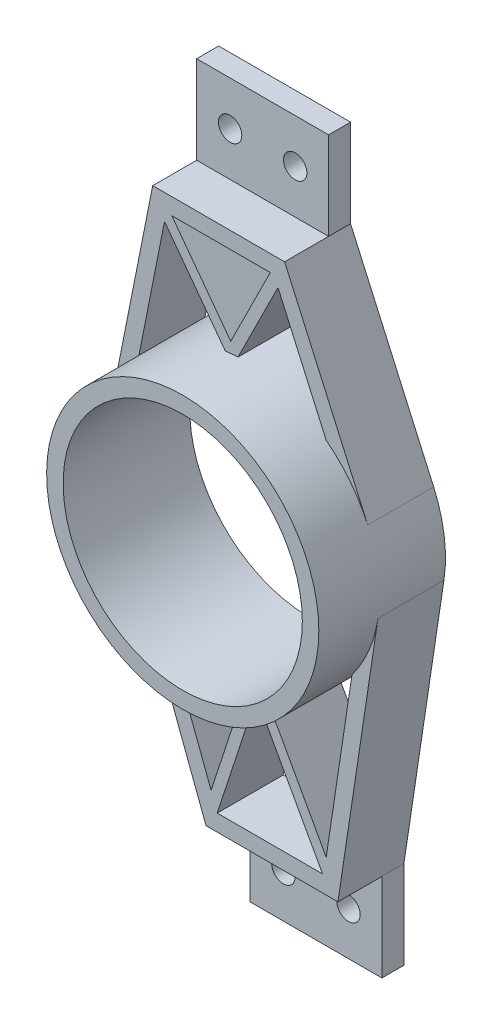
from build123d import *

# Parameters (mm, degrees)
MAIN_START                  = -6.35
MAIN_BODY_EXTRUDE_OUTLINE_R = 34.544
MAIN_BODY_EXTRUDE_DEPTH     = 19.05
A_START                     = -12.7
SKETCH3_W                   = 38.1
SKETCH3_H                   = 25.4
A_ARM_CUT_EXTRUDE_DEPTH     = 12.7
SKETCH2_R                   = 39.3065
SKETCH2_R_2                 = 34.544
WHEEL_BEARING_EXTRUDE_DEPTH = 17.526
F_1_4_CLEARANCE_HOLE1_D     = 6.7564


# Read off the part's stored shape, not the designer's step: Main Body Extrude
with BuildPart() as part:
    # Main Body Extrude outline → Main Body Extrude (new body)
    with BuildSketch(Plane.XY.offset(MAIN_START)):
        with BuildLine():
            Line((27.480731972, 99.845136477), (39.047879642, 176.532662304))
            ThreePointArc((39.047879642, 176.532662304), (39.130976131, 187.677399272), (36.082648081, 198.397462855))
            Line((36.082648081, 198.397462855), (12.081280182, 252.245136477))
            Line((12.081280182, 252.245136477), (12.081280182, 277.645136477))
            Line((12.081280182, 277.645136477), (-26.018719818, 277.645136477))
            Line((-26.018719818, 277.645136477), (-26.018719818, 252.245136477))
            Line((-26.018719818, 252.245136477), (-38.372251652, 190.053187868))
            ThreePointArc((-38.372251652, 190.053187868), (-38.990928758, 179.14568581), (-36.583444609, 168.489214415))
            Line((-36.583444609, 168.489214415), (-10.619268028, 99.845136477))
            Line((-10.619268028, 99.845136477), (-10.619268028, 74.445136477))
            Line((-10.619268028, 74.445136477), (27.480731972, 74.445136477))
            Line((27.480731972, 74.445136477), (27.480731972, 99.845136477))
        make_face()
        with BuildLine():
            ThreePointArc((-25.494117557, 152.632946315), (-12.721668299, 145.266691439), (1.866319763, 143.124782188))
            Line((1.866319763, 143.124782188), (-9.153762694, 109.432323748))
            Line((-9.153762694, 109.432323748), (-25.494117557, 152.632946315))
        make_face(mode=Mode.SUBTRACT)
        Polygon((-7.391297603, 104.607636477), (3.945650004, 139.268868599), (23.044050934, 104.607636477), align=None, mode=Mode.SUBTRACT)
        with BuildLine():
            ThreePointArc((5.282813212, 143.421136093), (19.947813793, 148.420513168), (31.541530581, 158.698730145))
            Line((31.541530581, 158.698730145), (24.089008073, 109.290221793))
            Line((24.089008073, 109.290221793), (5.282813212, 143.421136093))
        make_face(mode=Mode.SUBTRACT)
        with BuildLine():
            ThreePointArc((-5.038778466, 221.353506402), (-18.844806738, 216.790174549), (-30.047186356, 207.519947737))
            Line((-30.047186356, 207.519947737), (-22.604404483, 244.989483896))
            Line((-22.604404483, 244.989483896), (-5.038778466, 221.353506402))
        make_face(mode=Mode.SUBTRACT)
        Polygon((-3.478576257, 224.576955104), (-20.501465739, 247.482636477), (7.934620863, 247.482636477), align=None, mode=Mode.SUBTRACT)
        with Locations((0.181025656, 182.395136477)):
            Circle(MAIN_BODY_EXTRUDE_OUTLINE_R, mode=Mode.SUBTRACT)
        with BuildLine():
            Line((-1.379394493, 221.670650875), (10.166551929, 244.842753057))
            Line((10.166551929, 244.842753057), (24.09762487, 213.588039906))
            ThreePointArc((24.09762487, 213.588039906), (12.067229239, 219.861376035), (-1.379394493, 221.670650875))
        make_face(mode=Mode.SUBTRACT)
    extrude(amount=MAIN_BODY_EXTRUDE_DEPTH)

    # Sketch3 → A Arm Cut Extrude (cut)
    with BuildSketch(Plane.XY.offset(12.7).offset(A_START)):
        with Locations((-6.968719818, 264.945136477)):
            Rectangle(SKETCH3_W, SKETCH3_H)
        with Locations((8.430731972, 87.145136477)):
            Rectangle(SKETCH3_W, SKETCH3_H)
    extrude(amount=A_ARM_CUT_EXTRUDE_DEPTH, mode=Mode.SUBTRACT)

    # Sketch2 → Wheel Bearing Extrude (add)
    with BuildSketch(Plane.XY.offset(12.7)):
        with Locations(Location((0.181025656, 182.395136477, 0), (0, 0, 168.765257697))):
            Circle(SKETCH2_R)
        with Locations((0.181025656, 182.395136477)):
            Circle(SKETCH2_R_2, mode=Mode.SUBTRACT)
    extrude(amount=WHEEL_BEARING_EXTRUDE_DEPTH)

    # 1/4 Clearance Hole1 (through all)
    with Locations(Plane(origin=(-16.366719818, 264.945136477, 0), x_dir=(1, 0, 0), z_dir=(0, 0, 1))):
        with Locations((0, 0), (18.796, 0), (15.39945179, -177.8), (34.19545179, -177.8)):
            Hole(F_1_4_CLEARANCE_HOLE1_D / 2)


solid = part.part
